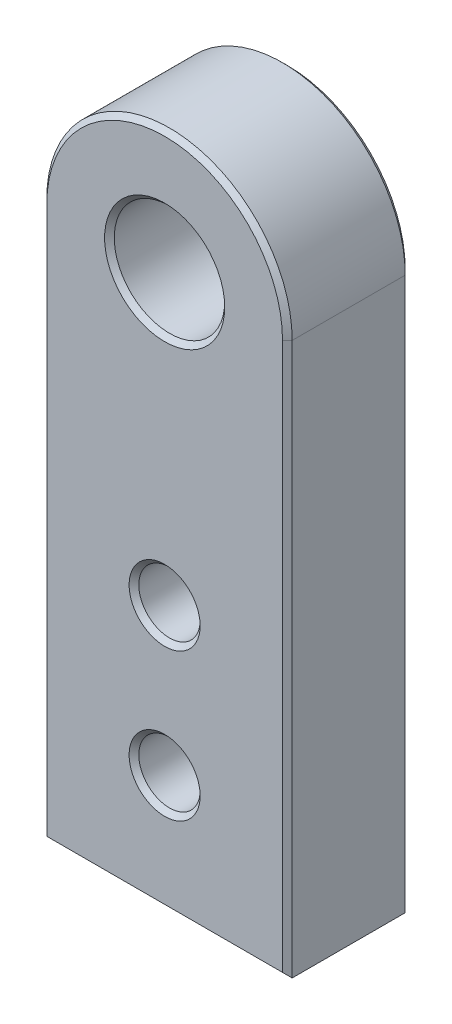
from build123d import *

# Parameters (mm, degrees)
SKETCH1_R           = 5.715
SKETCH1_R_2         = 3.175
BOSS_EXTRUDE1_DEPTH = 12.7
CHAMFER1_SIZE       = 0.5


with BuildPart() as part:
    # Sketch1 → Boss-Extrude1 (new body)
    with BuildSketch(Plane.XY):
        with BuildLine():
            Line((0, 0), (25.4, 0))
            Line((25.4, 0), (25.4, 40.64))
            Line((25.4, 40.64), (25.4, 57.15))
            ThreePointArc((25.4, 57.15), (12.7, 69.85), (0, 57.15))
            Line((0, 57.15), (0, 40.64))
            Line((0, 40.64), (0, 0))
        make_face()
        with Locations((12.7, 57.15)):
            Circle(SKETCH1_R, mode=Mode.SUBTRACT)
        with Locations((12.7, 27.305)):
            Circle(SKETCH1_R_2, mode=Mode.SUBTRACT)
        with Locations((12.7, 12.065)):
            Circle(SKETCH1_R_2, mode=Mode.SUBTRACT)
    extrude(amount=BOSS_EXTRUDE1_DEPTH)

    # Chamfer1
    chamfer1_edges = [part.edges().sort_by_distance(p)[0] for p in [
        (9.525, 12.065, 0),
        (6.985, 57.15, 0),
        (9.525, 27.305, 0),
        (25.4, 28.575, 0),
        (12.7, 69.85, 0),
        (0, 28.575, 0),
        (12.7, 0, 0),
        (9.525, 12.065, 12.7),
        (9.525, 27.305, 12.7),
        (12.7, 69.85, 12.7),
        (25.4, 28.575, 12.7),
        (12.7, 0, 12.7),
        (0, 28.575, 12.7),
        (6.985, 57.15, 12.7),
    ]]
    chamfer(chamfer1_edges, length=CHAMFER1_SIZE)


solid = part.part
